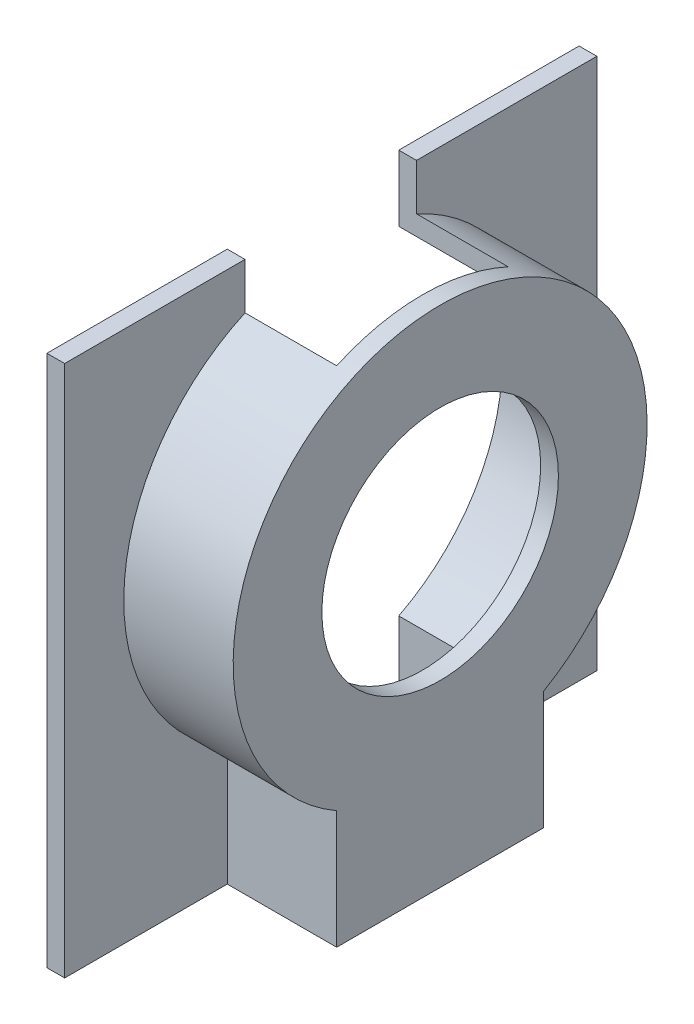
from build123d import *

# Parameters (mm, degrees)
SKETCH2_W               = 18
SKETCH2_H               = 18
BOSS_EXTRUDE1_DEPTH     = 4.3
BOSS_EXTRUDE2_DEPTH     = 3.7
SHELL2_T                = -0.6
SKETCH5_R               = 4
CUT_EXTRUDE1_DEPTH      = 16.033296378
CUT_EXTRUDE2_DEPTH      = 22.656407828
CUT_EXTRUDE2_DEPTH_BACK = 22.656407828


with BuildPart() as part:
    # Sketch2 → Boss-Extrude1 (new body)
    with BuildSketch(Plane(origin=(0, 0, 0), x_dir=(0, 0, -1), z_dir=(1, 0, 0))):
        Rectangle(SKETCH2_W, SKETCH2_H)
    extrude(amount=BOSS_EXTRUDE1_DEPTH)

    # Sketch4 → Boss-Extrude2 (add)
    with BuildSketch(Plane(origin=(4.3, 0, 0), x_dir=(0, 0, -1), z_dir=(1, 0, 0))):
        with BuildLine():
            Line((-3.5, -9), (3.5, -9))
            Line((3.5, -9), (3.5, -5))
            ThreePointArc((3.5, -5), (0, 8.062177826), (-3.5, -5))
            Line((-3.5, -5), (-3.5, -9))
        make_face()
    extrude(amount=BOSS_EXTRUDE2_DEPTH)

    # Shell2
    shell2_openings = [part.faces().sort_by_distance(p)[0] for p in [
        (0, 0, 0),
    ]]
    offset(amount=SHELL2_T, openings=shell2_openings, kind=Kind.INTERSECTION)

    # Sketch5 → Cut-Extrude1 (cut, through all)
    with BuildSketch(Plane(origin=(8, 0, 0), x_dir=(0, 0, -1), z_dir=(1, 0, 0))):
        with Locations((0, 1.062177826)):
            Circle(SKETCH5_R)
    extrude(amount=-CUT_EXTRUDE1_DEPTH, mode=Mode.SUBTRACT)

    # Sketch6 → Cut-Extrude2 (cut, two sides: drawn at the far end of the back side and taken through both)
    with BuildSketch(Plane(origin=(0, -9, 0), x_dir=(1, 0, 0), z_dir=(0, 1, 0)).offset(-CUT_EXTRUDE2_DEPTH_BACK)):
        Polygon((0, 40.044644084), (0, -8.574280431), (0, -9), (3.7, -9), (3.7, -8.4), (3.7, -2.9), (7.4, -2.9), (7.4, 2.9), (3.7, 2.9), (3.7, 8.4), (3.7, 9), (0, 9), (0, 8.4), (0, -8.4), (0, -57.018924515), (97.237849031, -57.018924515), (97.237849031, 40.044644084), align=None)
    extrude(amount=CUT_EXTRUDE2_DEPTH + CUT_EXTRUDE2_DEPTH_BACK, mode=Mode.SUBTRACT)


solid = part.part
